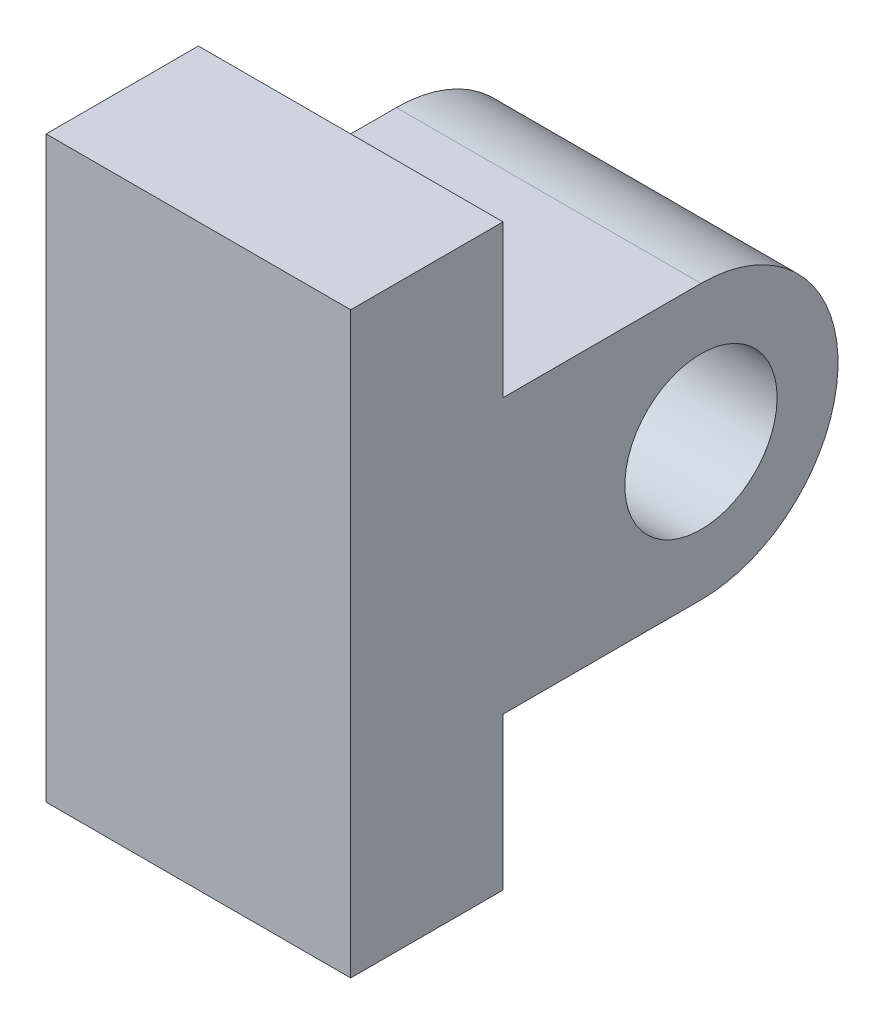
from build123d import *

# Parameters (mm, degrees)
SKETCH2_R           = 2.5
BOSS_EXTRUDE1_DEPTH = 5


with BuildPart() as part:
    # Sketch2 → Boss-Extrude1 (new, symmetric)
    with BuildSketch(Plane(origin=(0, 0, 0), x_dir=(0, 0, -1), z_dir=(1, 0, 0))):
        with BuildLine():
            Line((2.5, -4.5), (9, -4.5))
            ThreePointArc((9, -4.5), (13.5, 0), (9, 4.5))
            Line((9, 4.5), (2.5, 4.5))
            Line((2.5, 4.5), (2.5, 9.5))
            Line((2.5, 9.5), (-2.5, 9.5))
            Line((-2.5, 9.5), (-2.5, -9.5))
            Line((-2.5, -9.5), (2.5, -9.5))
            Line((2.5, -9.5), (2.5, -4.5))
        make_face()
        with Locations((9, 0)):
            Circle(SKETCH2_R, mode=Mode.SUBTRACT)
    extrude(amount=BOSS_EXTRUDE1_DEPTH, both=True)


solid = part.part
